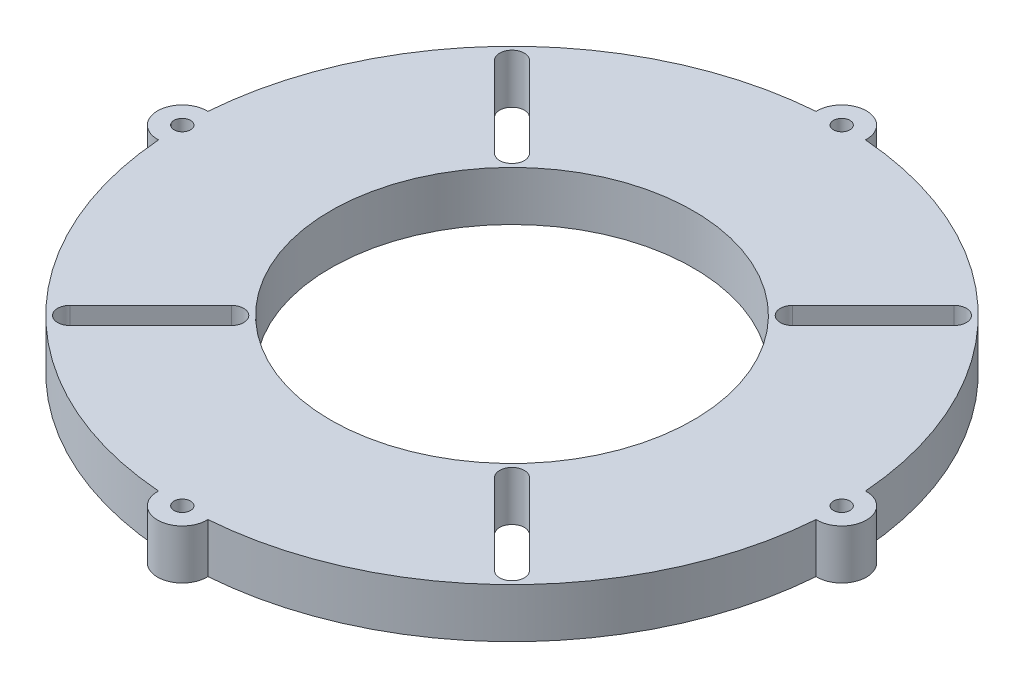
from build123d import *

# Parameters (mm, degrees)
SKETCH1_R           = 40
SKETCH1_R_2         = 22
BOSS_EXTRUDE1_DEPTH = 6
SKETCH2_R           = 1
CUT_EXTRUDE2_DEPTH  = 57.885850613
SKETCH2_6_R         = 3
SKETCH2_6_R_2       = 1
BOSS_EXTRUDE3_DEPTH = 6
CIRPATTERN1_COUNT   = 4
CUT_EXTRUDE4_DEPTH  = 62.10646447
CIRPATTERN3_COUNT   = 4


with BuildPart() as part:
    # Sketch1 → Boss-Extrude1 (new body)
    with BuildSketch(Plane(origin=(0, 0, 0), x_dir=(1, 0, 0), z_dir=(0, 1, 0))):
        Circle(SKETCH1_R)
        Circle(SKETCH1_R_2, mode=Mode.SUBTRACT)
    extrude(amount=BOSS_EXTRUDE1_DEPTH)

    # Sketch2 → Cut-Extrude2 (cut, through all)
    with BuildSketch(Plane(origin=(0, 6, 0), x_dir=(1, 0, 0), z_dir=(0, 1, 0))):
        with Locations((40, 0)):
            Circle(SKETCH2_R)
    cut_extrude2 = extrude(amount=-CUT_EXTRUDE2_DEPTH, mode=Mode.SUBTRACT)

    # Sketch2<6> → Boss-Extrude3 (add)
    with BuildSketch(Plane(origin=(0, 6, 0), x_dir=(1, 0, 0), z_dir=(0, 1, 0))):
        with Locations((40, 0)):
            Circle(SKETCH2_6_R)
        with Locations((40, 0)):
            Circle(SKETCH2_6_R_2, mode=Mode.SUBTRACT)
    boss_extrude3 = extrude(amount=-BOSS_EXTRUDE3_DEPTH)

    # CirPattern1: Cut-Extrude2, Boss-Extrude3 ×4 about axis
    cirpattern1_axis = Axis((0, 6, 0), (0, 1, 0))
    add([cut_extrude2.rotate(cirpattern1_axis, i * 360 / CIRPATTERN1_COUNT) for i in range(1, CIRPATTERN1_COUNT)], mode=Mode.SUBTRACT)
    add([boss_extrude3.rotate(cirpattern1_axis, i * 360 / CIRPATTERN1_COUNT) for i in range(1, CIRPATTERN1_COUNT)])

    # Sketch4 → Cut-Extrude4 (cut, through all)
    with BuildSketch(Plane(origin=(0, 6, 0), x_dir=(1, 0, 0), z_dir=(0, 1, 0))):
        with BuildLine():
            Line((-27.874930765, -25.753610422), (-18.087010012, -15.965689668))
            ThreePointArc((-18.087010012, -15.965689668), (-15.965689668, -15.965689668), (-15.965689668, -18.087010012))
            Line((-15.965689668, -18.087010012), (-25.753610422, -27.874930765))
            ThreePointArc((-25.753610422, -27.874930765), (-27.874930765, -27.874930765), (-27.874930765, -25.753610422))
        make_face()
    cut_extrude4 = extrude(amount=-CUT_EXTRUDE4_DEPTH, mode=Mode.SUBTRACT)

    # CirPattern3: Cut-Extrude4 ×4 about axis
    cirpattern3_axis = Axis((0, 6, 0), (0, 1, 0))
    for i in range(1, CIRPATTERN3_COUNT):
        add(cut_extrude4.rotate(cirpattern3_axis, i * 360 / CIRPATTERN3_COUNT), mode=Mode.SUBTRACT)


solid = part.part
